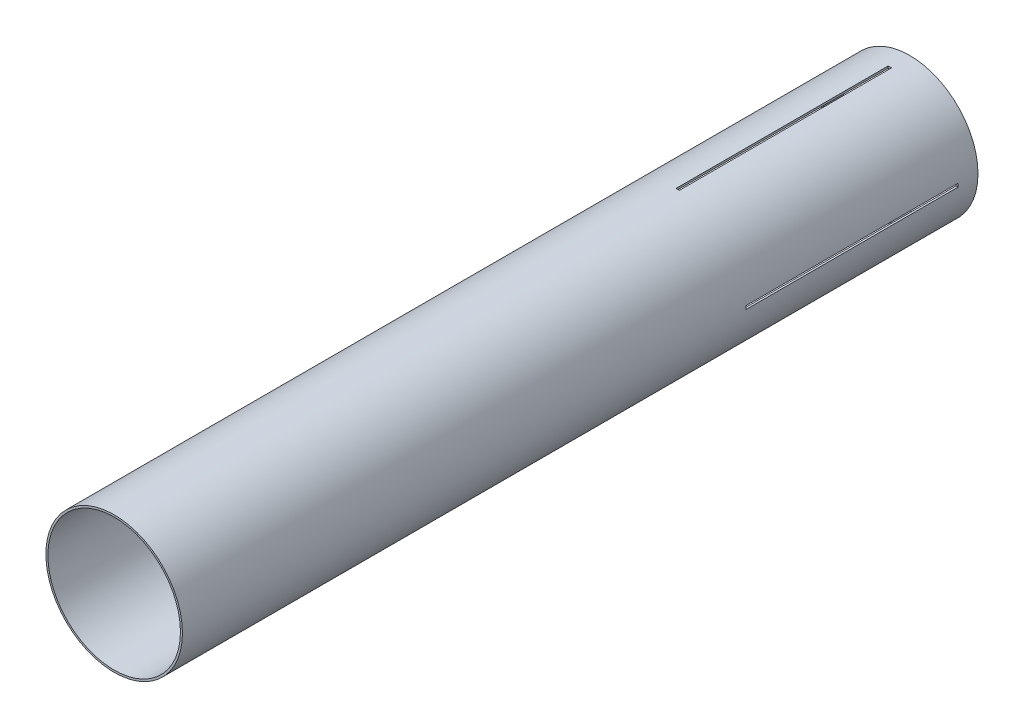
from build123d import *

# Parameters (mm, degrees)
SKETCH1_R           = 65.405
SKETCH1_R_2         = 63.5
BOSS_EXTRUDE1_DEPTH = 381
SKETCH3_W           = 3.175
SKETCH3_H           = 203.2
CUT_EXTRUDE1_DEPTH  = 393.067121868
CIRPATTERN1_COUNT   = 4


with BuildPart() as part:
    # Sketch1 → Boss-Extrude1 (new, symmetric)
    with BuildSketch(Plane.XY):
        Circle(SKETCH1_R)
        Circle(SKETCH1_R_2, mode=Mode.SUBTRACT)
    extrude(amount=BOSS_EXTRUDE1_DEPTH, both=True)

    # Sketch3 → Cut-Extrude1 (cut, through all)
    with BuildSketch(Plane(origin=(0, 0, 0), x_dir=(1, 0, 0), z_dir=(0, 1, 0))):
        with Locations((0, 260.35)):
            Rectangle(SKETCH3_W, SKETCH3_H)
    cut_extrude1 = extrude(amount=CUT_EXTRUDE1_DEPTH, mode=Mode.SUBTRACT)

    # CirPattern1: Cut-Extrude1 ×4 about axis
    cirpattern1_axis = Axis((0, 0, 381), (0, 0, -1))
    for i in range(1, CIRPATTERN1_COUNT):
        add(cut_extrude1.rotate(cirpattern1_axis, i * 360 / CIRPATTERN1_COUNT), mode=Mode.SUBTRACT)


solid = part.part
